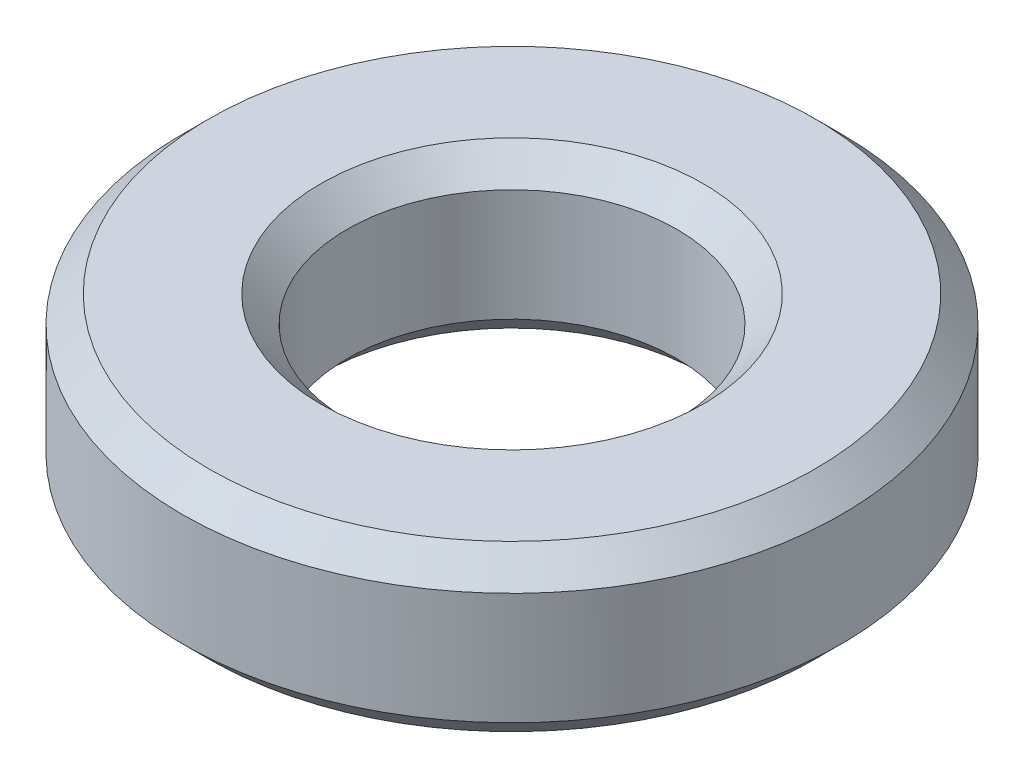
from build123d import *

# Parameters (mm, degrees)
SKETCH1_W     = 1.5875
SKETCH1_H     = 1.5875
CHAMFER1_SIZE = 0.254


with BuildPart() as part:
    # Sketch1 → Revolve1 (revolve)
    with BuildSketch(Plane.XY):
        with Locations((2.38125, 0)):
            Rectangle(SKETCH1_W, SKETCH1_H)
    revolve(axis=Axis((0, 0, 0), (0, 1, 0)))

    # Chamfer1
    chamfer1_edges = [part.edges().sort_by_distance(p)[0] for p in [
        (-3.175, -0.79375, 0),
        (-3.175, 0.79375, 0),
        (-1.5875, 0.79375, 0),
        (-1.5875, -0.79375, 0),
    ]]
    chamfer(chamfer1_edges, length=CHAMFER1_SIZE)


solid = part.part
